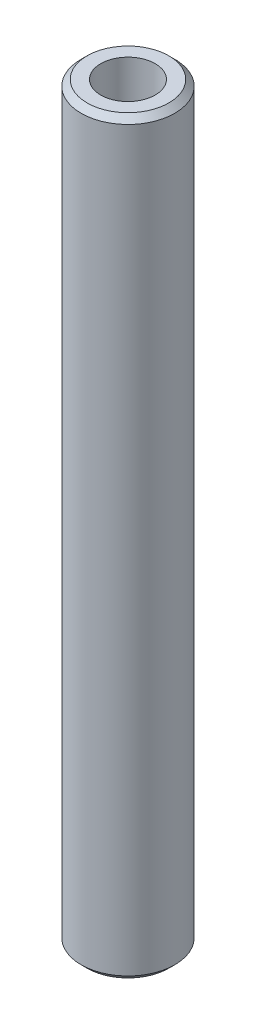
from build123d import *

# Parameters (mm, degrees)
SKETCH1_R           = 37.5
BOSS_EXTRUDE1_DEPTH = 600
SKETCH2_R           = 21.806146831
CUT_EXTRUDE1_DEPTH  = 603.339190158
CHAMFER1_SIZE       = 4.787134003


with BuildPart() as part:
    # Sketch1 → Boss-Extrude1 (new body)
    with BuildSketch(Plane(origin=(0, 0, 0), x_dir=(1, 0, 0), z_dir=(0, 1, 0))):
        Circle(SKETCH1_R)
    extrude(amount=BOSS_EXTRUDE1_DEPTH)

    # Sketch2 → Cut-Extrude1 (cut, through all)
    with BuildSketch(Plane(origin=(0, 0, 0), x_dir=(1, 0, 0), z_dir=(0, 1, 0))):
        Circle(SKETCH2_R)
    extrude(amount=CUT_EXTRUDE1_DEPTH, mode=Mode.SUBTRACT)

    # Chamfer1
    chamfer1_edges = [part.edges().sort_by_distance(p)[0] for p in [
        (-37.5, 600, 0),
        (-37.5, 0, 0),
    ]]
    chamfer(chamfer1_edges, length=CHAMFER1_SIZE)


solid = part.part
